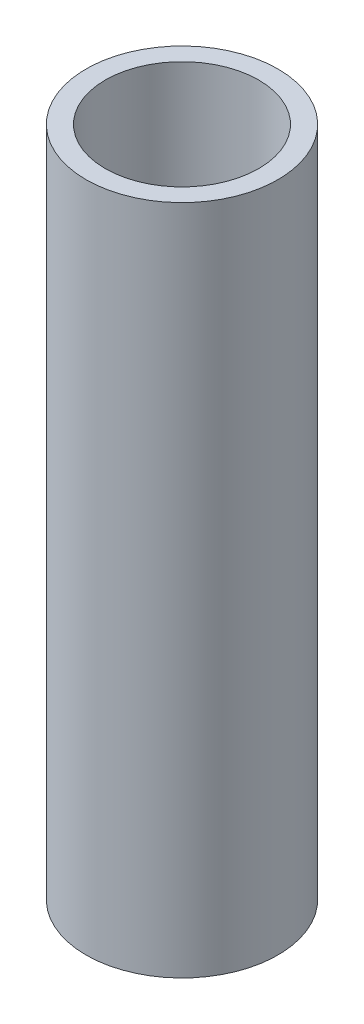
from build123d import *

# Parameters (mm, degrees)
CROQUIS1_R              = 5
CROQUIS1_R_2            = 4
SALIENTE_EXTRUIR1_DEPTH = 35


with BuildPart() as part:
    # Croquis1 → Saliente-Extruir1 (new body)
    with BuildSketch(Plane(origin=(0, 0, 0), x_dir=(1, 0, 0), z_dir=(0, 1, 0))):
        Circle(CROQUIS1_R)
        Circle(CROQUIS1_R_2, mode=Mode.SUBTRACT)
    extrude(amount=SALIENTE_EXTRUIR1_DEPTH)


solid = part.part
